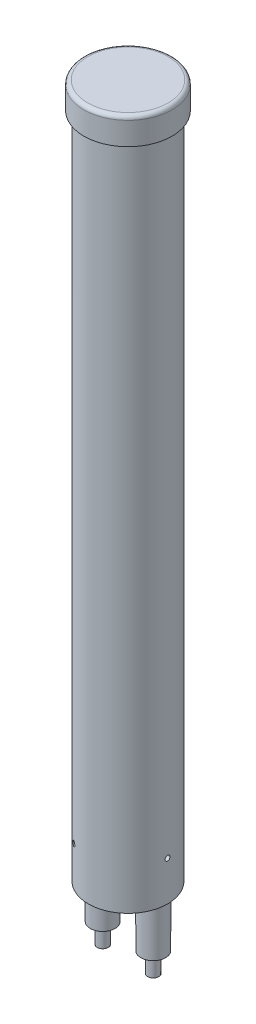
from build123d import *

# Parameters (mm, degrees)
SKETCH1_R                = 20
BOSS_EXTRUDE1_DEPTH      = 345
BOSS_EXTRUDE2_DEPTH      = 5
BOSS_EXTRUDE2_DEPTH_BACK = 8.5
SKETCH2_R                = 22.25
FILLET1_R                = 2
SKETCH3_R                = 1.25
CUT_EXTRUDE1_DEPTH       = 5
CIRPATTERN1_COUNT        = 3
SKETCH4_R                = 6.25
BOSS_EXTRUDE3_DEPTH      = 24
SKETCH5_R                = 2.8
BOSS_EXTRUDE4_DEPTH      = 10


with BuildPart() as part:
    # Sketch1 → Boss-Extrude1 (new body)
    with BuildSketch(Plane(origin=(0, 0, 0), x_dir=(1, 0, 0), z_dir=(0, 1, 0))):
        Circle(SKETCH1_R)
    extrude(amount=BOSS_EXTRUDE1_DEPTH)

    # Sketch2 → Boss-Extrude2 (add, two sides: drawn at the far end of the back side and taken through both)
    with BuildSketch(Plane(origin=(0, 345, 0), x_dir=(1, 0, 0), z_dir=(0, 1, 0)).offset(-BOSS_EXTRUDE2_DEPTH_BACK)):
        Circle(SKETCH2_R)
    extrude(amount=BOSS_EXTRUDE2_DEPTH + BOSS_EXTRUDE2_DEPTH_BACK)

    # Fillet1
    fillet1_edges = [part.edges().sort_by_distance(p)[0] for p in [
        (-22.25, 350, 0),
    ]]
    fillet(fillet1_edges, radius=FILLET1_R)

    # Sketch3 → Cut-Extrude1 (cut)
    with BuildSketch(Plane(origin=(20, 0, 0), x_dir=(0, 0, -1), z_dir=(1, 0, 0))):
        with Locations((0, 20)):
            Circle(SKETCH3_R)
    cut_extrude1 = extrude(amount=-CUT_EXTRUDE1_DEPTH, mode=Mode.SUBTRACT)

    # CirPattern1: Cut-Extrude1 ×3 about axis
    cirpattern1_axis = Axis((0, 345, 0), (0, -1, 0))
    for i in range(1, CIRPATTERN1_COUNT):
        add(cut_extrude1.rotate(cirpattern1_axis, i * 360 / CIRPATTERN1_COUNT), mode=Mode.SUBTRACT)

    # Sketch4 → Boss-Extrude3 (add)
    with BuildSketch(Plane.XZ):
        with Locations((-12.75, 0)):
            Circle(SKETCH4_R)
        with Locations((12.75, 0)):
            Circle(SKETCH4_R)
    extrude(amount=BOSS_EXTRUDE3_DEPTH)

    # Sketch5 → Boss-Extrude4 (add)
    with BuildSketch(Plane.XZ.offset(24)):
        with Locations((-12.75, 0)):
            Circle(SKETCH5_R)
        with Locations((12.75, 0)):
            Circle(SKETCH5_R)
    extrude(amount=BOSS_EXTRUDE4_DEPTH)


solid = part.part
